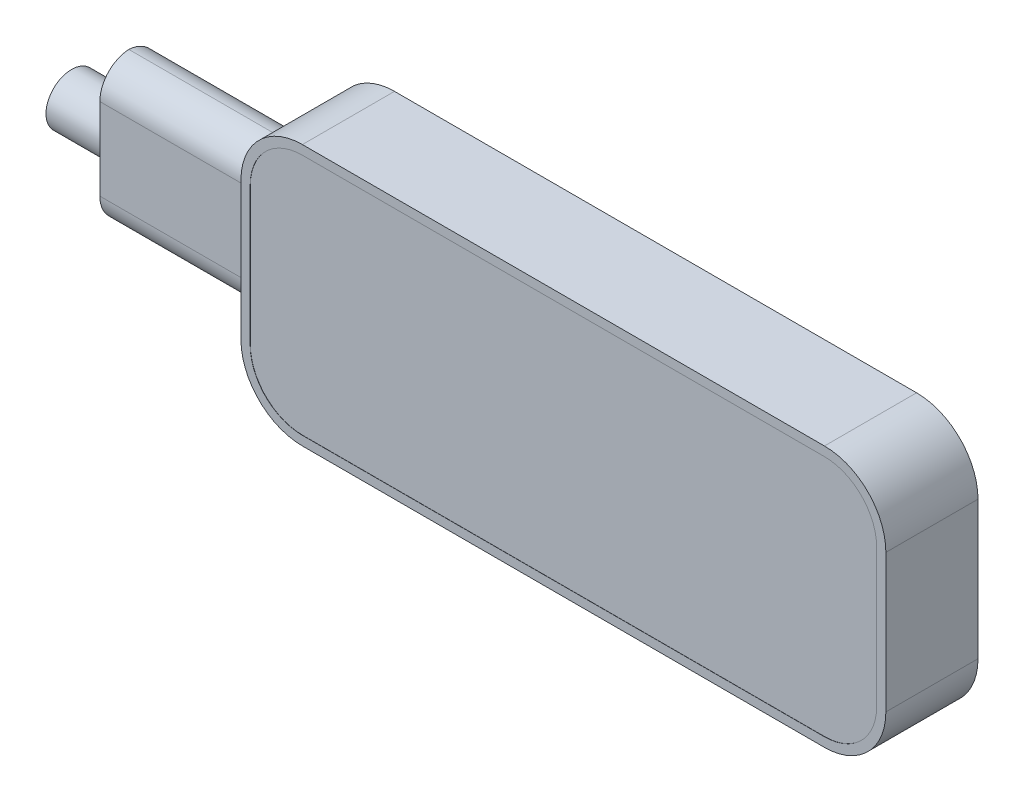
from build123d import *

# Parameters (mm, degrees)
SKETCH2_W           = 80.01
SKETCH2_H           = 32.385
BOSS_EXTRUDE1_DEPTH = 11.43
FILLET1_R           = 7.62
CUT_EXTRUDE1_DEPTH  = 0.0254
SKETCH5_W           = 3.175
SKETCH5_H           = 13.462
CUT_EXTRUDE2_DEPTH  = 5.08
BOSS_EXTRUDE2_START = 0.0254
SKETCH6_W           = 7.1882
SKETCH6_H           = 17.78
BOSS_EXTRUDE2_DEPTH = 20.6502
FILLET2_R           = 3.81
SKETCH7_R           = 3.175
BOSS_EXTRUDE3_DEPTH = 7.112


with BuildPart() as part:
    # Sketch2 → Boss-Extrude1 (new body)
    with BuildSketch(Plane.XY):
        Rectangle(SKETCH2_W, SKETCH2_H)
    extrude(amount=BOSS_EXTRUDE1_DEPTH)

    # Fillet1
    fillet1_edges = [part.edges().sort_by_distance(p)[0] for p in [
        (-40.005, 16.1925, 5.715),
        (40.005, 16.1925, 5.715),
        (40.005, -16.1925, 5.715),
        (-40.005, -16.1925, 5.715),
    ]]
    fillet(fillet1_edges, radius=FILLET1_R)

    # Sketch4 → Cut-Extrude1 (cut)
    with BuildSketch(Plane.XY.offset(11.43)):
        with BuildLine():
            Line((-38.862, 8.5725), (-38.862, -8.5725))
            ThreePointArc((-38.862, -8.5725), (-36.964930622, -13.152430622), (-32.385, -15.0495))
            Line((-32.385, -15.0495), (32.385, -15.0495))
            ThreePointArc((32.385, -15.0495), (36.964930622, -13.152430622), (38.862, -8.5725))
            Line((38.862, -8.5725), (38.862, 8.5725))
            ThreePointArc((38.862, 8.5725), (36.964930622, 13.152430622), (32.385, 15.0495))
            Line((32.385, 15.0495), (-32.385, 15.0495))
            ThreePointArc((-32.385, 15.0495), (-36.964930622, 13.152430622), (-38.862, 8.5725))
        make_face()
    extrude(amount=-CUT_EXTRUDE1_DEPTH, mode=Mode.SUBTRACT)

    # Sketch5 → Cut-Extrude2 (cut)
    with BuildSketch(Plane.ZY.offset(40.005)):
        with Locations((4.151118715, 0)):
            Rectangle(SKETCH5_W, SKETCH5_H)
    extrude(amount=-CUT_EXTRUDE2_DEPTH, mode=Mode.SUBTRACT)


with BuildPart() as body_2:
    # Sketch6 → Boss-Extrude2 (new body)
    with BuildSketch(Plane.ZY.offset(40.005).offset(BOSS_EXTRUDE2_START)):
        with Locations((4.666570246, 0)):
            Rectangle(SKETCH6_W, SKETCH6_H)
    extrude(amount=BOSS_EXTRUDE2_DEPTH)

    # Fillet2
    # the kernel refuses this fillet: 3.81 mm, written as the material it takes off along each edge
    with BuildSketch(Plane(origin=(-30.5054, -8.89, 1.072470246), x_dir=(0, 0, 1), z_dir=(-1, 0, 0)), Plane(origin=(-30.5054, -8.89, 8.260670246), x_dir=(0, 1, 0), z_dir=(-1, 0, 0)), Plane(origin=(-30.5054, 8.89, 8.260670246), x_dir=(0, 0, -1), z_dir=(-1, 0, 0))) as fillet2_piece_1:
        with BuildLine():
            CenterArc((FILLET2_R, FILLET2_R), FILLET2_R, 180, 90)
            Line((0, FILLET2_R), (0, 0))
            Line((0, 0), (FILLET2_R, 0))
        make_face()
    extrude(amount=39.7002, mode=Mode.SUBTRACT)
    with BuildSketch(Plane(origin=(-30.5054, 8.89, 1.072470246), x_dir=(0, 0, 1), z_dir=(-1, 0, 0))) as fillet2_piece_2:
        with BuildLine():
            CenterArc((FILLET2_R, -FILLET2_R), FILLET2_R, 90, 90)
            Line((0, -FILLET2_R), (0, 0))
            Line((0, 0), (FILLET2_R, 0))
        make_face()
    extrude(amount=39.7002, mode=Mode.SUBTRACT)

    # Sketch7 → Boss-Extrude3 (add)
    with BuildSketch(Plane.ZY.offset(60.6806)):
        with Locations((4.653668075, 0)):
            Circle(SKETCH7_R)
    extrude(amount=BOSS_EXTRUDE3_DEPTH)


solid = Compound([part.part, body_2.part])
